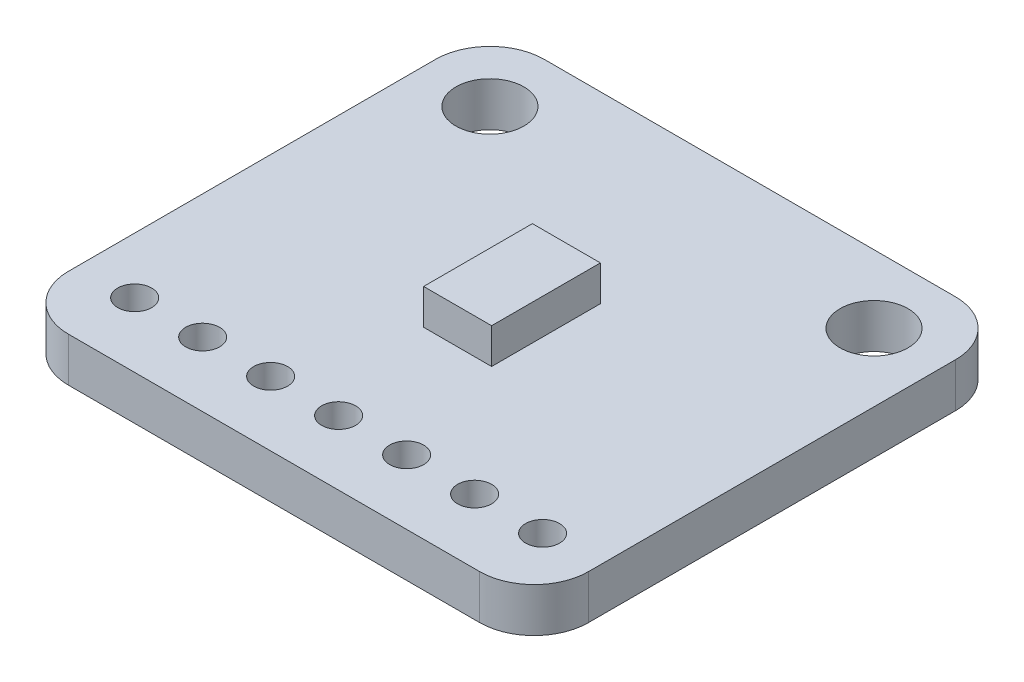
from build123d import *

# Parameters (mm, degrees)
SKETCH1_R           = 1.27
SKETCH1_R_2         = 0.635
BOSS_EXTRUDE1_DEPTH = 1.651
SKETCH2_W           = 2.54
SKETCH2_H           = 4.064
BOSS_EXTRUDE2_DEPTH = 1.3208


with BuildPart() as part:
    # Sketch1 → Boss-Extrude1 (new body)
    with BuildSketch(Plane(origin=(0, 0, 0), x_dir=(1, 0, 0), z_dir=(0, 1, 0))):
        with BuildLine():
            Line((2.032, 0), (17.399, 0))
            ThreePointArc((17.399, 0), (18.835840979, 0.595159021), (19.431, 2.032))
            Line((19.431, 2.032), (19.431, 15.748))
            ThreePointArc((19.431, 15.748), (18.835840979, 17.184840979), (17.399, 17.78))
            Line((17.399, 17.78), (2.032, 17.78))
            ThreePointArc((2.032, 17.78), (0.595159021, 17.184840979), (0, 15.748))
            Line((0, 15.748), (0, 2.032))
            ThreePointArc((0, 2.032), (0.595159021, 0.595159021), (2.032, 0))
        make_face()
        with Locations((2.54, 15.24)):
            Circle(SKETCH1_R, mode=Mode.SUBTRACT)
        with Locations((16.891, 15.24)):
            Circle(SKETCH1_R, mode=Mode.SUBTRACT)
        with Locations((2.0955, 2.413)):
            Circle(SKETCH1_R_2, mode=Mode.SUBTRACT)
        with Locations((4.6355, 2.413)):
            Circle(SKETCH1_R_2, mode=Mode.SUBTRACT)
        with Locations((7.1755, 2.413)):
            Circle(SKETCH1_R_2, mode=Mode.SUBTRACT)
        with Locations((9.7155, 2.413)):
            Circle(SKETCH1_R_2, mode=Mode.SUBTRACT)
        with Locations((12.2555, 2.413)):
            Circle(SKETCH1_R_2, mode=Mode.SUBTRACT)
        with Locations((14.7955, 2.413)):
            Circle(SKETCH1_R_2, mode=Mode.SUBTRACT)
        with Locations((17.3355, 2.413)):
            Circle(SKETCH1_R_2, mode=Mode.SUBTRACT)
    extrude(amount=BOSS_EXTRUDE1_DEPTH)

    # Sketch2 → Boss-Extrude2 (add)
    with BuildSketch(Plane(origin=(0, 1.651, 0), x_dir=(1, 0, 0), z_dir=(0, 1, 0))):
        with Locations((9.7155, 8.89)):
            Rectangle(SKETCH2_W, SKETCH2_H)
    extrude(amount=BOSS_EXTRUDE2_DEPTH)


solid = part.part
